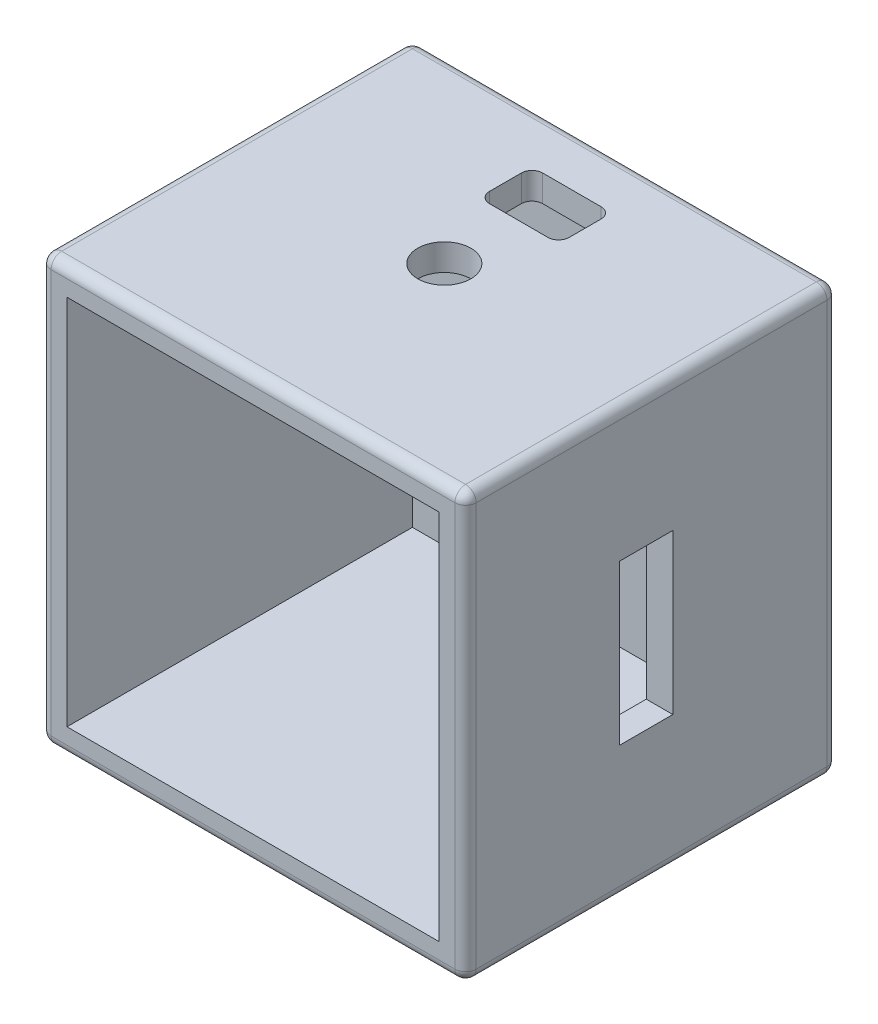
from build123d import *

# Parameters (mm, degrees)
SKETCH_1_W          = 80
SKETCH_1_H          = 80
EXTRUDE_1_DEPTH     = 70
SKETCH_2_W          = 70
SKETCH_2_H          = 70
CUT_EXTRUDE_1_DEPTH = 65
FILLET_1_R          = 2
FILLET_2_R          = 2
FILLET_3_R          = 2
CUT_EXTRUDE_3_DEPTH = 10
SKETCH_4_W          = 10
SKETCH_4_H          = 30
CUT_EXTRUDE_4_DEPTH = 10
SKETCH_5_R          = 5
CUT_EXTRUDE_5_DEPTH = 10
FILLET_4_R          = 2


with BuildPart() as part:
    # Эскиз1 → Бобышка-Вытянуть1 (new body)
    with BuildSketch(Plane.XY):
        Rectangle(SKETCH_1_W, SKETCH_1_H)
    extrude(amount=EXTRUDE_1_DEPTH)

    # Эскиз2 → Вырез-Вытянуть1 (cut)
    with BuildSketch(Plane.XY.offset(70)):
        Rectangle(SKETCH_2_W, SKETCH_2_H)
    extrude(amount=-CUT_EXTRUDE_1_DEPTH, mode=Mode.SUBTRACT)

    # Скругление1
    fillet_1_edges = [part.edges().sort_by_distance(p)[0] for p in [
        (-40, 40, 35),
        (-40, -40, 35),
    ]]
    fillet(fillet_1_edges, radius=FILLET_1_R)

    # Скругление2
    fillet_2_edges = [part.edges().sort_by_distance(p)[0] for p in [
        (1, -40, 0),
        (-40, 0, 0),
        (-39.414213562, 39.414213562, 0),
        (-39.414213562, -39.414213562, 0),
        (1, 40, 0),
        (40, 0, 0),
        (40, 40, 35),
    ]]
    fillet(fillet_2_edges, radius=FILLET_2_R)

    # Скругление3
    # the kernel refuses this fillet: 2 mm, written as the material it takes off along each edge
    with BuildSketch(Plane(origin=(38, -38, 2), x_dir=(1, 0, 0), z_dir=(0, -1, 0))) as fillet_3_piece_1_section:
        Polygon((0, 0), (FILLET_3_R, 0), (FILLET_3_R, -FILLET_3_R), (0, -FILLET_3_R), align=None)
    fillet_3_piece_1 = extrude(amount=FILLET_3_R, mode=Mode.PRIVATE)
    fillet_3_piece_1 = fillet_3_piece_1 - Plane(origin=(38, -38, 2), x_dir=(-0.7071067811865475, 0, 0.7071067811865475), z_dir=(0, -1, 0)) * Sphere(FILLET_3_R, mode=Mode.PRIVATE)
    add(fillet_3_piece_1, mode=Mode.SUBTRACT)
    with BuildSketch(Plane(origin=(40, -40, 2), x_dir=(-1, 0, 0), z_dir=(0, 0, 1))) as fillet_3_piece_2:
        with BuildLine():
            CenterArc((FILLET_3_R, -FILLET_3_R), FILLET_3_R, 90, 90)
            Line((0, -FILLET_3_R), (0, 0))
            Line((0, 0), (FILLET_3_R, 0))
        make_face()
    extrude(amount=73, mode=Mode.SUBTRACT)

    # Эскиз3 → Вырез-Вытянуть3 (cut)
    with BuildSketch(Plane(origin=(0, 40, 0), x_dir=(1, 0, 0), z_dir=(0, 1, 0))):
        with BuildLine():
            Line((5.5, -20), (-5.5, -20))
            ThreePointArc((-5.5, -20), (-6.914213562, -19.414213562), (-7.5, -18))
            Line((-7.5, -18), (-7.5, -12))
            ThreePointArc((-7.5, -12), (-6.914213562, -10.585786438), (-5.5, -10))
            Line((-5.5, -10), (5.5, -10))
            ThreePointArc((5.5, -10), (6.914213562, -10.585786438), (7.5, -12))
            Line((7.5, -12), (7.5, -18))
            ThreePointArc((7.5, -18), (6.914213562, -19.414213562), (5.5, -20))
        make_face()
    extrude(amount=-CUT_EXTRUDE_3_DEPTH, mode=Mode.SUBTRACT)

    # Эскиз4 → Вырез-Вытянуть4 (cut)
    with BuildSketch(Plane(origin=(40, 0, 0), x_dir=(0, 0, -1), z_dir=(1, 0, 0))):
        with Locations((-36, 0)):
            Rectangle(SKETCH_4_W, SKETCH_4_H)
    extrude(amount=-CUT_EXTRUDE_4_DEPTH, mode=Mode.SUBTRACT)

    # Эскиз5 → Вырез-Вытянуть5 (cut)
    with BuildSketch(Plane(origin=(0, 40, 0), x_dir=(1, 0, 0), z_dir=(0, 1, 0))):
        with Locations(Location((0, -34, 0), (0, 0, 270))):
            Circle(SKETCH_5_R)
    extrude(amount=-CUT_EXTRUDE_5_DEPTH, mode=Mode.SUBTRACT)

    # Скругление4
    fillet_4_edges = [part.edges().sort_by_distance(p)[0] for p in [
        (0, -40, 70),
        (-40, 0, 70),
        (-39.414213562, 39.414213562, 70),
        (-39.414213562, -39.414213562, 70),
        (0, 40, 70),
        (39.414213562, 39.414213562, 70),
        (40, 0, 70),
        (39.414213562, -39.414213562, 70),
    ]]
    fillet(fillet_4_edges, radius=FILLET_4_R)


solid = part.part
